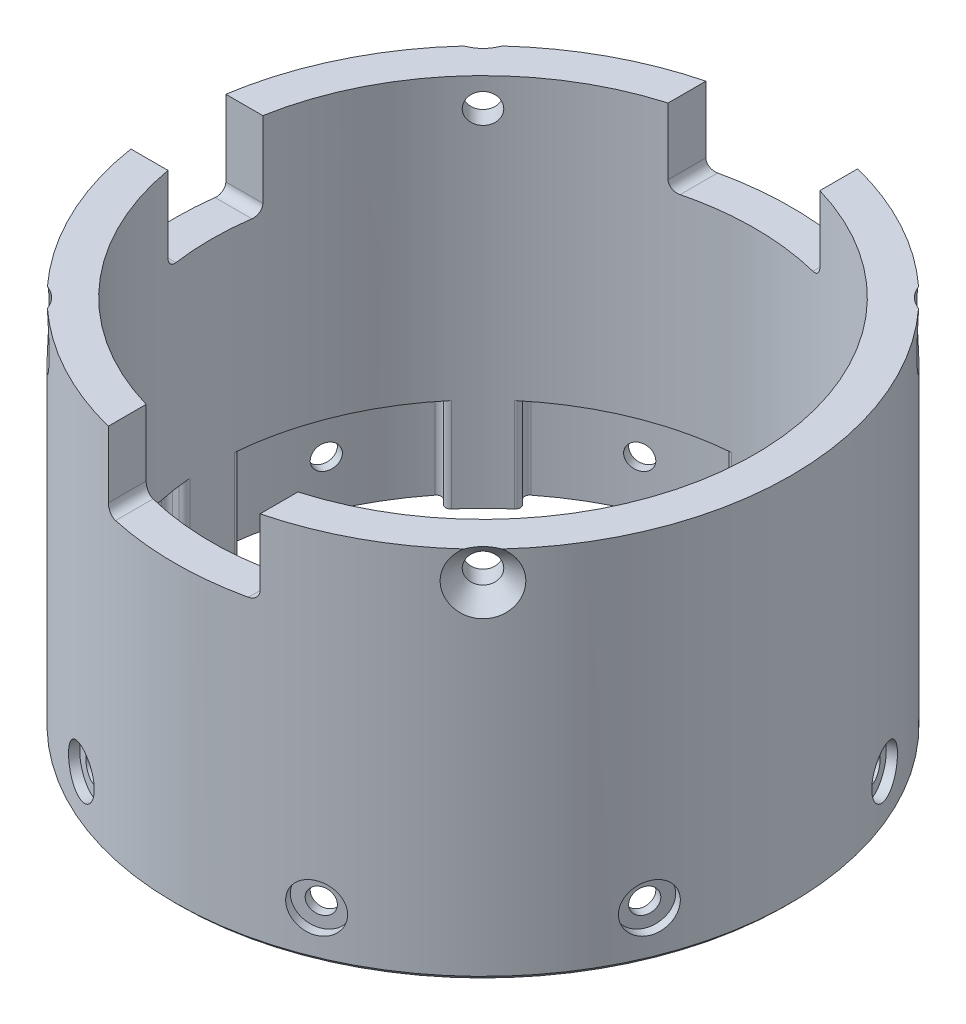
from build123d import *

# Parameters (mm, degrees)
SKETCH_1_R               = 32.5
SKETCH_1_R_2             = 28.65
EXTRUDE_1_DEPTH          = 39.5
CUT_EXTRUDE_START        = -32.5
CUT_EXTRUDE_11_OUTLINE_W = 10
CUT_EXTRUDE_11_OUTLINE_H = 9
CUT_EXTRUDE_11_DEPTH     = 4.289673876
SKETCH_20_R              = 1.55
CUT_EXTRUDE_12_DEPTH     = 7
PATTERN_CIRCULAR_3_COUNT = 4
PATTERN_CIRCULAR_5_COUNT = 4
CHAMFER_1_SIZE           = 0.5
CUT_EXTRUDE_START_2      = -8
CUT_EXTRUDE_13_DEPTH     = 8
FILLET_3_R               = 1
CUT_EXTRUDE_21_DEPTH     = 9.9
FILLET_6_R               = 0.55
FILLET_7_R               = 0.55
SKETCH_41_R              = 2.5
CUT_EXTRUDE_22_DEPTH     = 1
PATTERN_CIRCULAR_7_COUNT = 8
SKETCH_42_R              = 1.3
CUT_EXTRUDE_23_DEPTH     = 10
PATTERN_CIRCULAR_8_COUNT = 8
FILLET_8_R               = 0.55


# Read off the part's stored shape, not the designer's step: 切除-拉伸11
with BuildPart() as part:
    # 草图1 → 凸台-拉伸1 (new body)
    with BuildSketch(Plane(origin=(0, 0, 0), x_dir=(1, 0, 0), z_dir=(0, 1, 0))):
        with Locations(Location((0, 0, 0), (0, 0, 270))):
            Circle(SKETCH_1_R)
        with Locations(Location((0, 0, 0), (0, 0, 270))):
            Circle(SKETCH_1_R_2, mode=Mode.SUBTRACT)
    extrude(amount=EXTRUDE_1_DEPTH)

    # 切除-拉伸11 outline → 切除-拉伸11 (cut)
    with BuildSketch(Plane(origin=(0, 0, 0), x_dir=(0, 0, -1), z_dir=(1, 0, 0)).offset(CUT_EXTRUDE_START)):
        with Locations((0, 35)):
            Rectangle(CUT_EXTRUDE_11_OUTLINE_W, CUT_EXTRUDE_11_OUTLINE_H)
    extrude(amount=CUT_EXTRUDE_11_DEPTH, mode=Mode.SUBTRACT)

    # 草图20 → 切除-拉伸12 (cut)
    with BuildSketch(Plane(origin=(22.980970389, 0, -22.980970389), x_dir=(0, 1, 0), z_dir=(-0.7071067811865488, 0, 0.7071067811865464))):
        with Locations(Location((36.5, 0, 0), (0, 0, 90))):
            Circle(SKETCH_20_R)
    cut_extrude_12 = extrude(amount=CUT_EXTRUDE_12_DEPTH, mode=Mode.SUBTRACT)

    # 阵列(圆周)3: 切除-拉伸12 ×4 about axis
    pattern_circular_3_axis = Axis((0, 39.5, 0), (0, -1, 0))
    for i in range(1, PATTERN_CIRCULAR_3_COUNT):
        add(cut_extrude_12.rotate(pattern_circular_3_axis, i * 360 / PATTERN_CIRCULAR_3_COUNT), mode=Mode.SUBTRACT)

    # 草图22 → 切除-旋转1 (revolve, cut)
    with BuildSketch(Plane(origin=(0, 0, 0), x_dir=(0.7071067811865465, 0, 0.7071067811865487), z_dir=(-0.7071067811865487, 0, 0.7071067811865465)), mode=Mode.PRIVATE) as cut_revolve_1_sk:
        Polygon((29.15, 36.5), (32.5, 36.5), (32.5, 33.15), align=None)
    cut_revolve_1 = revolve(cut_revolve_1_sk.sketch.rotate(Axis((21.611821341, 36.5, 21.611821341), (0.7071067811865466, 0, 0.7071067811865486)), 90), axis=Axis((21.611821341, 36.5, 21.611821341), (0.7071067811865466, 0, 0.7071067811865486)), mode=Mode.SUBTRACT)

    # 阵列(圆周)5: 切除-旋转1 ×4 about axis
    pattern_circular_5_axis = Axis((0, 0, 0), (0, 1, 0))
    for i in range(1, PATTERN_CIRCULAR_5_COUNT):
        add(cut_revolve_1.rotate(pattern_circular_5_axis, i * 360 / PATTERN_CIRCULAR_5_COUNT), mode=Mode.SUBTRACT)

    # 倒角1
    chamfer_1_edges = [part.edges().sort_by_distance(p)[0] for p in [
        (0, 0, -32.5),
    ]]
    chamfer(chamfer_1_edges, length=CHAMFER_1_SIZE)

    # 草图24 → 切除-拉伸13 (cut)
    with BuildSketch(Plane(origin=(0, 39.5, 0), x_dir=(1, 0, 0), z_dir=(0, 1, 0)).offset(CUT_EXTRUDE_START_2)):
        with BuildLine():
            Line((-8, 31.5), (-8, 27.510407122))
            ThreePointArc((-8, 27.510407122), (0, 28.65), (8, 27.510407122))
            Line((8, 27.510407122), (8, 31.5))
            ThreePointArc((8, 31.5), (0, 32.5), (-8, 31.5))
        make_face()
        with BuildLine():
            Line((-8, -27.510407122), (-8, -31.5))
            ThreePointArc((-8, -31.5), (0, -32.5), (8, -31.5))
            Line((8, -31.5), (8, -27.510407122))
            ThreePointArc((8, -27.510407122), (0, -28.65), (-8, -27.510407122))
        make_face()
    extrude(amount=CUT_EXTRUDE_13_DEPTH, mode=Mode.SUBTRACT)

    # 圆角3
    fillet_3_edges = [part.edges().sort_by_distance(p)[0] for p in [
        (8, 31.5, -29.505203561),
        (-8, 31.5, -29.505203561),
        (8, 31.5, 29.505203561),
        (-8, 31.5, 29.505203561),
        (-30.161703785, 30.5, 5),
        (-30.161703785, 30.5, -5),
    ]]
    fillet(fillet_3_edges, radius=FILLET_3_R)

    # 草图40 → 切除-拉伸21 (cut)
    with BuildSketch(Plane.XZ):
        with BuildLine():
            Line((28.497719207, 2.95), (30.407235981, 2.95))
            ThreePointArc((30.407235981, 2.95), (28.224519718, 11.690978859), (23.587127764, 19.415197755))
            Line((23.587127764, 19.415197755), (22.236895504, 18.064965495))
            ThreePointArc((22.236895504, 18.064965495), (26.469148606, 10.963880337), (28.497719207, 2.95))
        make_face()
        with BuildLine():
            Line((28.497719207, -2.95), (30.407235981, -2.95))
            ThreePointArc((30.407235981, -2.95), (28.224519718, -11.690978859), (23.587127764, -19.415197755))
            Line((23.587127764, -19.415197755), (22.236895504, -18.064965495))
            ThreePointArc((22.236895504, -18.064965495), (26.469148606, -10.963880337), (28.497719207, -2.95))
        make_face()
        with BuildLine():
            Line((18.064965495, -22.236895504), (19.415197755, -23.587127764))
            ThreePointArc((19.415197755, -23.587127764), (11.690978859, -28.224519718), (2.95, -30.407235981))
            Line((2.95, -30.407235981), (2.95, -28.497719207))
            ThreePointArc((2.95, -28.497719207), (10.963880337, -26.469148606), (18.064965495, -22.236895504))
        make_face()
        with BuildLine():
            Line((-2.95, -28.497719207), (-2.95, -30.407235981))
            ThreePointArc((-2.95, -30.407235981), (-11.690978859, -28.224519718), (-19.415197755, -23.587127764))
            Line((-19.415197755, -23.587127764), (-18.064965495, -22.236895504))
            ThreePointArc((-18.064965495, -22.236895504), (-10.963880337, -26.469148606), (-2.95, -28.497719207))
        make_face()
        with BuildLine():
            Line((-22.236895504, -18.064965495), (-23.587127764, -19.415197755))
            ThreePointArc((-23.587127764, -19.415197755), (-28.224519718, -11.690978859), (-30.407235981, -2.95))
            Line((-30.407235981, -2.95), (-28.497719207, -2.95))
            ThreePointArc((-28.497719207, -2.95), (-26.469148606, -10.963880337), (-22.236895504, -18.064965495))
        make_face()
        with BuildLine():
            Line((-28.497719207, 2.95), (-30.407235981, 2.95))
            ThreePointArc((-30.407235981, 2.95), (-28.224519718, 11.690978859), (-23.587127764, 19.415197755))
            Line((-23.587127764, 19.415197755), (-22.236895504, 18.064965495))
            ThreePointArc((-22.236895504, 18.064965495), (-26.469148606, 10.963880337), (-28.497719207, 2.95))
        make_face()
        with BuildLine():
            Line((-18.064965495, 22.236895504), (-19.415197755, 23.587127764))
            ThreePointArc((-19.415197755, 23.587127764), (-11.690978859, 28.224519718), (-2.95, 30.407235981))
            Line((-2.95, 30.407235981), (-2.95, 28.497719207))
            ThreePointArc((-2.95, 28.497719207), (-10.963880337, 26.469148606), (-18.064965495, 22.236895504))
        make_face()
        with BuildLine():
            Line((2.95, 28.497719207), (2.95, 30.407235981))
            ThreePointArc((2.95, 30.407235981), (11.690978859, 28.224519718), (19.415197755, 23.587127764))
            Line((19.415197755, 23.587127764), (18.064965495, 22.236895504))
            ThreePointArc((18.064965495, 22.236895504), (10.963880337, 26.469148606), (2.95, 28.497719207))
        make_face()
    extrude(amount=-CUT_EXTRUDE_21_DEPTH, mode=Mode.SUBTRACT)

    # 圆角6
    fillet_6_edges = [part.edges().sort_by_distance(p)[0] for p in [
        (19.415197755, 4.95, 23.587127764),
        (-19.415197755, 4.95, 23.587127764),
        (-30.407235981, 4.95, 2.95),
        (-23.587127764, 4.95, 19.415197755),
        (-23.587127764, 4.95, -19.415197755),
        (-30.407235981, 4.95, -2.95),
        (-19.415197755, 4.95, -23.587127764),
        (19.415197755, 4.95, -23.587127764),
        (30.407235981, 4.95, -2.95),
        (23.587127764, 4.95, -19.415197755),
        (23.587127764, 4.95, 19.415197755),
        (30.407235981, 4.95, 2.95),
    ]]
    fillet(fillet_6_edges, radius=FILLET_6_R)

    # 圆角7
    fillet_7_edges = [part.edges().sort_by_distance(p)[0] for p in [
        (18.064965495, 4.95, 22.236895504),
        (-18.064965495, 4.95, 22.236895504),
        (-22.236895504, 4.95, 18.064965495),
        (-28.497719207, 4.95, 2.95),
        (-28.497719207, 4.95, -2.95),
        (-22.236895504, 4.95, -18.064965495),
        (-18.064965495, 4.95, -22.236895504),
        (18.064965495, 4.95, -22.236895504),
        (22.236895504, 4.95, -18.064965495),
        (28.497719207, 4.95, -2.95),
        (28.497719207, 4.95, 2.95),
        (22.236895504, 4.95, 18.064965495),
    ]]
    fillet(fillet_7_edges, radius=FILLET_7_R)

    # 草图41 → 切除-拉伸22 (cut)
    with BuildSketch(Plane(origin=(-30.026084807, 0, -12.437211552), x_dir=(0, -1, 0), z_dir=(-0.9238795325112852, 0, -0.38268343236509383))):
        with Locations(Location((-5, 0, 0), (0, 0, 90))):
            Circle(SKETCH_41_R)
    cut_extrude_22 = extrude(amount=-CUT_EXTRUDE_22_DEPTH, mode=Mode.SUBTRACT)

    # 阵列(圆周)7: 切除-拉伸22 ×8 about axis
    pattern_circular_7_axis = Axis((0, 0, 0), (0, 1, 0))
    for i in range(1, PATTERN_CIRCULAR_7_COUNT):
        add(cut_extrude_22.rotate(pattern_circular_7_axis, i * 360 / PATTERN_CIRCULAR_7_COUNT), mode=Mode.SUBTRACT)

    # 草图42 → 切除-拉伸23 (cut)
    with BuildSketch(Plane(origin=(-30.026084807, 0, -12.437211552), x_dir=(0, -1, 0), z_dir=(-0.9238795325112852, 0, -0.38268343236509383))):
        with Locations(Location((-5, 0, 0), (0, 0, 90))):
            Circle(SKETCH_42_R)
    cut_extrude_23 = extrude(amount=-CUT_EXTRUDE_23_DEPTH, mode=Mode.SUBTRACT)

    # 阵列(圆周)8: 切除-拉伸23 ×8 about axis
    pattern_circular_8_axis = Axis((0, 39.5, 0), (0, -1, 0))
    for i in range(1, PATTERN_CIRCULAR_8_COUNT):
        add(cut_extrude_23.rotate(pattern_circular_8_axis, i * 360 / PATTERN_CIRCULAR_8_COUNT), mode=Mode.SUBTRACT)

    # 圆角8
    fillet_8_edges = [part.edges().sort_by_distance(p)[0] for p in [
        (2.95, 4.95, 28.497719207),
        (2.95, 4.95, 30.407235981),
        (-2.95, 4.95, 28.497719207),
        (-2.95, 4.95, 30.407235981),
        (-2.95, 4.95, -28.497719207),
        (-2.95, 4.95, -30.407235981),
        (2.95, 4.95, -28.497719207),
        (2.95, 4.95, -30.407235981),
    ]]
    fillet(fillet_8_edges, radius=FILLET_8_R)


solid = part.part
